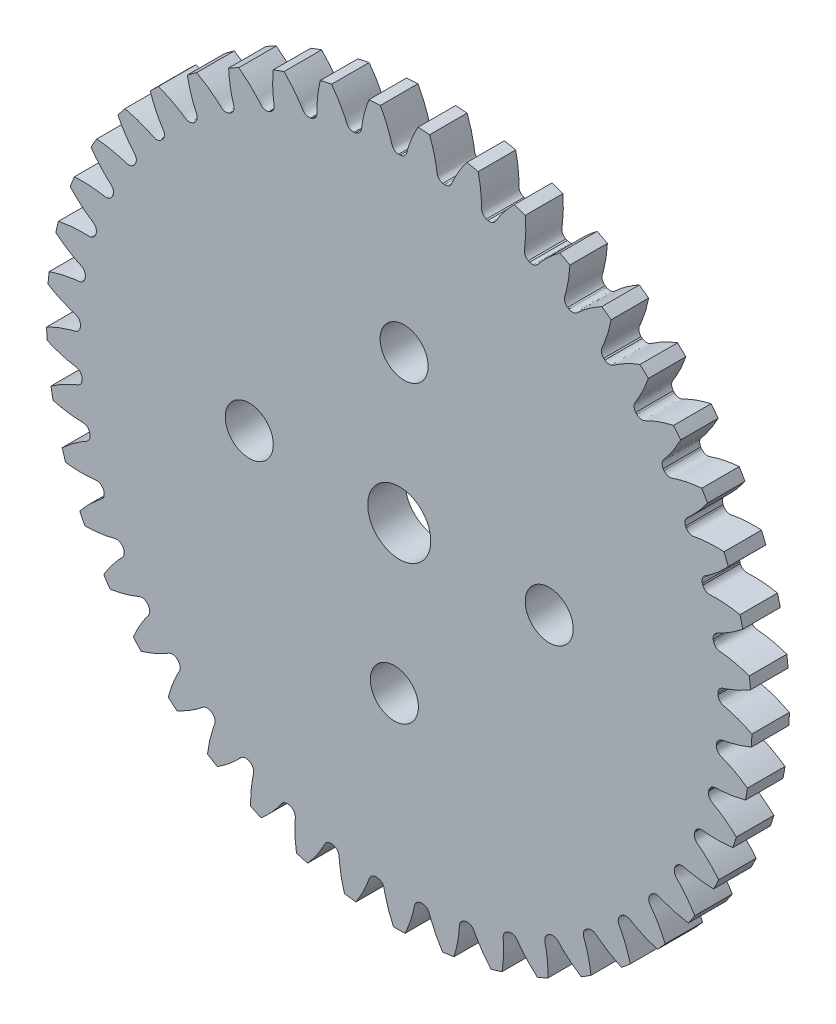
from build123d import *

# Parameters (mm, degrees)
SKETCH_1_R               = 23.5
EXTRUDE_1_DEPTH          = 2.5
CUT_EXTRUDE_1_DEPTH      = 34.327916226
PATTERN_CIRCULAR_1_COUNT = 45
SKETCH_4_R               = 2.1
CUT_EXTRUDE_2_DEPTH      = 10
SKETCH_5_R               = 1.6
CUT_EXTRUDE_3_DEPTH      = 10


with BuildPart() as part:
    # 草图1 → 凸台-拉伸1 (new body)
    with BuildSketch(Plane.XY):
        Circle(SKETCH_1_R)
    extrude(amount=EXTRUDE_1_DEPTH)

    # 草图2 → 切除-拉伸1 (cut, through all)
    with BuildSketch(Plane.XY):
        with BuildLine():
            ThreePointArc((0.051873264, 21.249936686), (0, 21.25), (-0.051873264, 21.249936686))
            add(Edge.make_bspline(
                [(-0.051873264, 21.249936686), (-0.443572136, 21.304099562), (-0.488057885, 21.594745963), (-0.580625684, 21.909595528), (-0.616187717, 22.023701477), (-0.656820366, 22.145031226), (-0.702678597, 22.273509106), (-0.754106978, 22.408946374), (-0.811388198, 22.551175843), (-0.874816981, 22.700012294), (-0.944678084, 22.855264244), (-1.021252408, 23.016730684), (-1.104814919, 23.184202197), (-1.195634949, 23.357460817), (-1.293975814, 23.536280256), (-1.400094629, 23.720426036), (-1.514242081, 23.909655655), (-1.636662209, 24.103718747), (-1.767592191, 24.302357255), (-1.907262137, 24.505305605), (-2.055894882, 24.712290888), (-2.213705786, 24.923033045), (-2.380902537, 25.137245056), (-2.557684962, 25.354633139), (-2.744244834, 25.574896952), (-2.940765714, 25.79772979), (-3.147422686, 26.022818809), (-3.44059804, 26.329597021), (-3.670417998, 26.555895846), (-3.828553255, 26.70565732)],
                knots=[0, 0, 0, 0, 0.112268392, 0.128789174, 0.146568276, 0.165605699, 0.185901442, 0.207455506, 0.23026789, 0.254338595, 0.27966762, 0.306254966, 0.334100632, 0.363204619, 0.393566926, 0.425187554, 0.458066503, 0.492203772, 0.527599361, 0.564253271, 0.602165502, 0.641336053, 0.681764924, 0.723452116, 0.766397629, 0.810601462, 0.856063616, 0.90278409, 1, 1, 1, 1], degree=3))
            ThreePointArc((-3.828553255, 26.70565732), (0, 26.978694426), (3.828553255, 26.70565732))
            add(Edge.make_bspline(
                [(0.051873264, 21.249936686), (0.443572136, 21.304099562), (0.488057885, 21.594745963), (0.580625684, 21.909595528), (0.616187717, 22.023701477), (0.656820366, 22.145031226), (0.702678597, 22.273509106), (0.754106978, 22.408946374), (0.811388198, 22.551175843), (0.874816981, 22.700012294), (0.944678084, 22.855264244), (1.021252408, 23.016730684), (1.104814919, 23.184202197), (1.195634949, 23.357460817), (1.293975814, 23.536280256), (1.400094629, 23.720426036), (1.514242081, 23.909655655), (1.636662209, 24.103718747), (1.767592191, 24.302357255), (1.907262137, 24.505305605), (2.055894882, 24.712290888), (2.213705786, 24.923033045), (2.380902537, 25.137245056), (2.557684962, 25.354633139), (2.744244834, 25.574896952), (2.940765714, 25.79772979), (3.147422686, 26.022818809), (3.44059804, 26.329597021), (3.670417998, 26.555895846), (3.828553255, 26.70565732)],
                knots=[0, 0, 0, 0, 0.112268392, 0.128789174, 0.146568276, 0.165605699, 0.185901442, 0.207455506, 0.23026789, 0.254338595, 0.27966762, 0.306254966, 0.334100632, 0.363204619, 0.393566926, 0.425187554, 0.458066503, 0.492203772, 0.527599361, 0.564253271, 0.602165502, 0.641336053, 0.681764924, 0.723452116, 0.766397629, 0.810601462, 0.856063616, 0.90278409, 1, 1, 1, 1], degree=3))
        make_face()
    cut_extrude_1 = extrude(amount=CUT_EXTRUDE_1_DEPTH, mode=Mode.SUBTRACT)

    # 阵列(圆周)1: 切除-拉伸1 ×45 about axis
    pattern_circular_1_axis = Axis((0, 0, 2.5), (0, 0, -1))
    for i in range(1, PATTERN_CIRCULAR_1_COUNT):
        add(cut_extrude_1.rotate(pattern_circular_1_axis, i * 360 / PATTERN_CIRCULAR_1_COUNT), mode=Mode.SUBTRACT)

    # 草图4 → 切除-拉伸2 (cut)
    with BuildSketch(Plane.XY.offset(2.5)):
        Circle(SKETCH_4_R)
    extrude(amount=-CUT_EXTRUDE_2_DEPTH, mode=Mode.SUBTRACT)

    # 草图5 → 切除-拉伸3 (cut)
    with BuildSketch(Plane.XY.offset(2.5)):
        with Locations((-9.994730423, 0.32459785)):
            Circle(SKETCH_5_R)
        with Locations((0.32459785, 9.994730423)):
            Circle(SKETCH_5_R)
        with Locations((9.994730423, -0.32459785)):
            Circle(SKETCH_5_R)
        with Locations((-0.32459785, -9.994730423)):
            Circle(SKETCH_5_R)
    extrude(amount=-CUT_EXTRUDE_3_DEPTH, mode=Mode.SUBTRACT)


solid = part.part
